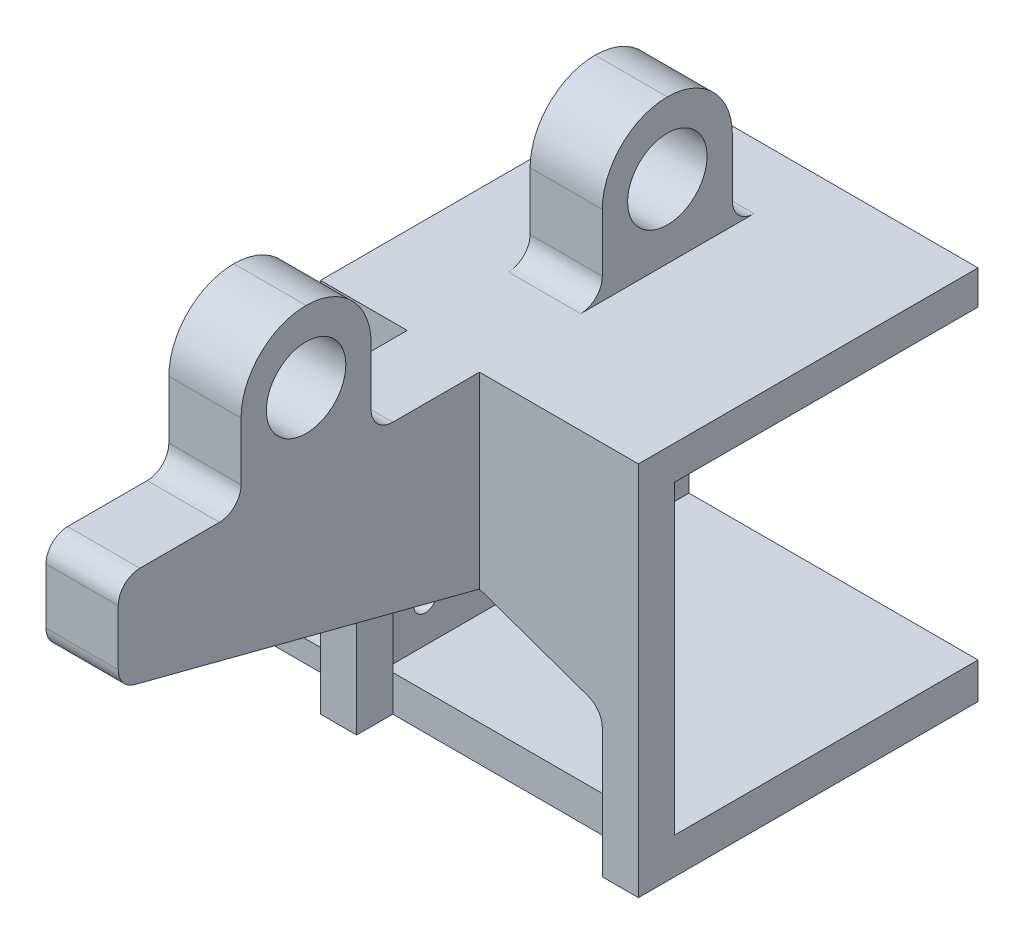
from build123d import *

# Parameters (mm, degrees)
SKETCH1_W            = 94
SKETCH1_H            = 42
BOSS_EXTRUDE1_DEPTH  = 3
SKETCH2_W            = 4
SKETCH2_H            = 42
BOSS_EXTRUDE2_DEPTH  = 47
SKETCH3_R            = 12.5
SKETCH3_R_2          = 1.6
CUT_EXTRUDE1_DEPTH   = 114.176852757
SKETCH4_W            = 42
SKETCH4_H            = 5
BOSS_EXTRUDE3_DEPTH  = 40
SKETCH5_W            = 42
SKETCH5_H            = 5
BOSS_EXTRUDE4_DEPTH  = 38
SKETCH7_W            = 42
SKETCH7_H            = 42
SKETCH7_W_2          = 44
BOSS_EXTRUDE6_DEPTH  = 5
SKETCH9_R            = 2.15
CUT_EXTRUDE2_DEPTH   = 149.731301346
SKETCH11_W           = 10
SKETCH11_H           = 18
BOSS_EXTRUDE7_DEPTH  = 20
SKETCH13_R           = 5.5
CUT_EXTRUDE3_DEPTH   = 169.988165266
BOSS_EXTRUDE11_DEPTH = 5
SKETCH23_W           = 10
SKETCH23_H           = 26
BOSS_EXTRUDE12_DEPTH = 50
CUT_EXTRUDE7_DEPTH   = 193.595430891
SKETCH25_W           = 10
SKETCH25_H           = 18
BOSS_EXTRUDE13_DEPTH = 20
SKETCH26_R           = 5.5
CUT_EXTRUDE8_DEPTH   = 193.595430891
SKETCH27_W           = 12
SKETCH27_H           = 18
BOSS_EXTRUDE14_DEPTH = 69
CUT_EXTRUDE10_START  = -5
SKETCH28_R           = 5.5
CUT_EXTRUDE10_DEPTH  = 5
SKETCH29_R           = 5.5
CUT_EXTRUDE11_DEPTH  = 5
FILLET4_R            = 9
FILLET3_R            = 3
SKETCH30_W           = 91
SKETCH30_H           = 42
CUT_EXTRUDE12_DEPTH  = 181.413414135
SKETCH31_W           = 40
SKETCH31_H           = 0.3
CUT_EXTRUDE13_DEPTH  = 42


# Some blends are built 0.0001 mm under size
with BuildPart() as part:
    # Sketch1 → Boss-Extrude1 (new body)
    with BuildSketch(Plane(origin=(0, 0, 0), x_dir=(1, 0, 0), z_dir=(0, 1, 0))):
        with Locations((47, -21)):
            Rectangle(SKETCH1_W, SKETCH1_H)
    extrude(amount=BOSS_EXTRUDE1_DEPTH)

    # Sketch2 → Boss-Extrude2 (add)
    with BuildSketch(Plane.XZ):
        with Locations((2, 21)):
            Rectangle(SKETCH2_W, SKETCH2_H)
        with Locations((92, 21)):
            Rectangle(SKETCH2_W, SKETCH2_H)
    extrude(amount=-BOSS_EXTRUDE2_DEPTH)

    # Sketch3 → Cut-Extrude1 (cut, through all)
    with BuildSketch(Plane(origin=(94, 0, 0), x_dir=(0, 0, -1), z_dir=(1, 0, 0))):
        with Locations((-21, 26)):
            Circle(SKETCH3_R)
        with Locations((-36.5, 41.5)):
            Circle(SKETCH3_R_2)
        with Locations((-5.5, 41.5)):
            Circle(SKETCH3_R_2)
        with Locations((-36.5, 10.5)):
            Circle(SKETCH3_R_2)
        with Locations((-5.5, 10.5)):
            Circle(SKETCH3_R_2)
    extrude(amount=-CUT_EXTRUDE1_DEPTH, mode=Mode.SUBTRACT)

    # Sketch4 → Boss-Extrude3 (add)
    with BuildSketch(Plane(origin=(94, 0, 0), x_dir=(0, 0, -1), z_dir=(1, 0, 0))):
        with Locations((-21, 2.5)):
            Rectangle(SKETCH4_W, SKETCH4_H)
    extrude(amount=BOSS_EXTRUDE3_DEPTH)

    # Sketch5 → Boss-Extrude4 (add)
    with BuildSketch(Plane.ZY):
        with Locations((21, 2.5)):
            Rectangle(SKETCH5_W, SKETCH5_H)
    extrude(amount=BOSS_EXTRUDE4_DEPTH)

    # Sketch7 → Boss-Extrude6 (add)
    with BuildSketch(Plane(origin=(0, 47, 0), x_dir=(1, 0, 0), z_dir=(0, 1, 0))):
        with Locations((-17, -21)):
            Rectangle(SKETCH7_W, SKETCH7_H)
        with Locations((112, -21)):
            Rectangle(SKETCH7_W_2, SKETCH7_H)
    extrude(amount=BOSS_EXTRUDE6_DEPTH)

    # Sketch9 → Cut-Extrude2 (cut, through all)
    with BuildSketch(Plane(origin=(0, 3, 0), x_dir=(1, 0, 0), z_dir=(0, 1, 0))):
        with Locations(Location((83, -21, 0), (0, 0, 270))):
            Circle(SKETCH9_R)
        with Locations(Location((65, -21, 0), (0, 0, 270))):
            Circle(SKETCH9_R)
        with Locations(Location((74, -12, 0), (0, 0, 270))):
            Circle(SKETCH9_R)
        with Locations(Location((74, -30, 0), (0, 0, 270))):
            Circle(SKETCH9_R)
        with Locations(Location((22, -12, 0), (0, 0, 270))):
            Circle(SKETCH9_R)
        with Locations(Location((22, -30, 0), (0, 0, 270))):
            Circle(SKETCH9_R)
    extrude(amount=-CUT_EXTRUDE2_DEPTH, mode=Mode.SUBTRACT)

    # Sketch11 → Boss-Extrude7 (add)
    with BuildSketch(Plane(origin=(0, 52, 0), x_dir=(1, 0, 0), z_dir=(0, 1, 0))):
        with Locations((-8, -21)):
            Rectangle(SKETCH11_W, SKETCH11_H)
        with Locations((107, -21)):
            Rectangle(SKETCH11_W, SKETCH11_H)
    extrude(amount=BOSS_EXTRUDE7_DEPTH)

    # Sketch13 → Cut-Extrude3 (cut, through all)
    with BuildSketch(Plane.ZY.offset(13)):
        with Locations((21, 62.15)):
            Circle(SKETCH13_R)
    extrude(amount=-CUT_EXTRUDE3_DEPTH, mode=Mode.SUBTRACT)

    # Sketch20 → Boss-Extrude11 (add)
    with BuildSketch(Plane.XY.offset(42)):
        Polygon((134, 0), (134, 52), (90, 52), (90, 0), (95, 0), (95, 20), (102, 26), (112, 26), (129, 20), (129, 0), align=None)
    extrude(amount=BOSS_EXTRUDE11_DEPTH)

    # Sketch23 → Boss-Extrude12 (add)
    with BuildSketch(Plane.XY.offset(47)):
        with Locations((107, 39)):
            Rectangle(SKETCH23_W, SKETCH23_H)
    extrude(amount=BOSS_EXTRUDE12_DEPTH)

    # Sketch24 → Cut-Extrude7 (cut, through all)
    with BuildSketch(Plane(origin=(112, 0, 0), x_dir=(0, 0, -1), z_dir=(1, 0, 0))):
        Polygon((-47, 26), (-97, 39), (-97, 26), align=None)
    extrude(amount=-CUT_EXTRUDE7_DEPTH, mode=Mode.SUBTRACT)

    # Sketch25 → Boss-Extrude13 (add)
    with BuildSketch(Plane(origin=(0, 52, 0), x_dir=(1, 0, 0), z_dir=(0, 1, 0))):
        with Locations((107, -71)):
            Rectangle(SKETCH25_W, SKETCH25_H)
    extrude(amount=BOSS_EXTRUDE13_DEPTH)

    # Sketch26 → Cut-Extrude8 (cut, through all)
    with BuildSketch(Plane(origin=(112, 0, 0), x_dir=(0, 0, -1), z_dir=(1, 0, 0))):
        with Locations((-71, 62.15)):
            Circle(SKETCH26_R)
    extrude(amount=-CUT_EXTRUDE8_DEPTH, mode=Mode.SUBTRACT)

    # Sketch27 → Boss-Extrude14 (add)
    with BuildSketch(Plane(origin=(0, 3, 0), x_dir=(1, 0, 0), z_dir=(0, 1, 0))):
        with Locations((47, -21)):
            Rectangle(SKETCH27_W, SKETCH27_H)
    extrude(amount=BOSS_EXTRUDE14_DEPTH)

    # Sketch28 → Cut-Extrude10 (cut)
    with BuildSketch(Plane(origin=(53, 0, 0), x_dir=(0, 0, -1), z_dir=(1, 0, 0)).offset(CUT_EXTRUDE10_START)):
        with Locations(Location((-21, 62.15, 0), (0, 0, 180))):
            Circle(SKETCH28_R)
    extrude(amount=CUT_EXTRUDE10_DEPTH, mode=Mode.SUBTRACT)

    # Sketch29 → Cut-Extrude11 (cut)
    with BuildSketch(Plane.ZY.offset(-41)):
        with Locations((21, 62.15)):
            Circle(SKETCH29_R)
    extrude(amount=-CUT_EXTRUDE11_DEPTH, mode=Mode.SUBTRACT)

    # Fillet4
    fillet4_edges = [part.edges().sort_by_distance(p)[0] for p in [
        (-8, 72, 12),
        (-8, 72, 30),
        (107, 72, 12),
        (107, 72, 30),
        (107, 72, 62),
        (107, 72, 80),
        (47, 72, 12),
        (47, 72, 30),
    ]]
    fillet(fillet4_edges, radius=FILLET4_R - 0.0001)  # a hair under: the kernel refuses the full size

    # Fillet3
    # the kernel refuses this fillet: 3 mm, written as the material it adds along each edge
    with BuildSketch(Plane(origin=(-3, 52, 30), x_dir=(0, 1, 0), z_dir=(-1, 0, 0)), Plane(origin=(112, 52, 80), x_dir=(0, 1, 0), z_dir=(-1, 0, 0))) as fillet3_piece_1:
        with BuildLine():
            CenterArc((FILLET3_R, -FILLET3_R), FILLET3_R, 90, 90)
            Line((0, -FILLET3_R), (0, 0))
            Line((0, 0), (FILLET3_R, 0))
        make_face()
    extrude(amount=10)
    with BuildSketch(Plane(origin=(-13, 52, 12), x_dir=(0, 0, -1), z_dir=(1, 0, 0)), Plane(origin=(112, 52, 30), x_dir=(0, 0, 1), z_dir=(-1, 0, 0)), Plane(origin=(102, 52, 12), x_dir=(0, 0, -1), z_dir=(1, 0, 0)), Plane(origin=(102, 52, 62), x_dir=(0, 0, -1), z_dir=(1, 0, 0))) as fillet3_piece_2:
        with BuildLine():
            CenterArc((FILLET3_R, FILLET3_R), FILLET3_R, 180, 90)
            Line((0, FILLET3_R), (0, 0))
            Line((0, 0), (FILLET3_R, 0))
        make_face()
    extrude(amount=10)
    with BuildSketch(Plane(origin=(95, 20, 42), x_dir=(0, -1, 0), z_dir=(0, 0, 1))) as fillet3_piece_3:
        with BuildLine():
            CenterArc((FILLET3_R * 0.45993492247, FILLET3_R), FILLET3_R, 220.601294645, 49.398705355)
            Line((-FILLET3_R * 0.299321679895, FILLET3_R * 0.349208626544), (0, 0))
            Line((0, 0), (FILLET3_R * 0.45993492247, 0))
        make_face()
    extrude(amount=5)
    with BuildSketch(Plane(origin=(102, 26, 42), x_dir=(-0.7592566023652966, -0.6507913734559685, 0), z_dir=(0, 0, 1))) as fillet3_piece_4:
        with BuildLine():
            CenterArc((FILLET3_R * 0.369924076215, FILLET3_R), FILLET3_R, 229.398705355, 40.601294645)
            Line((-FILLET3_R * 0.28086729724, FILLET3_R * 0.240743397635), (0, 0))
            Line((0, 0), (FILLET3_R * 0.369924076215, 0))
        make_face()
    extrude(amount=5)
    with BuildSketch(Plane(origin=(112, 26, 42), x_dir=(0.942990333582889, -0.3328201177351389, 0), z_dir=(0, 0, 1))) as fillet3_piece_5:
        with BuildLine():
            CenterArc((FILLET3_R * 0.171292729553, -FILLET3_R), FILLET3_R, 90, 19.440034828)
            Line((-FILLET3_R * 0.161527388182, -FILLET3_R * 0.0570096664171), (0, 0))
            Line((0, 0), (FILLET3_R * 0.171292729553, 0))
        make_face()
    extrude(amount=5)
    with BuildSketch(Plane(origin=(129, 20, 42), x_dir=(0, -1, 0), z_dir=(0, 0, 1))) as fillet3_piece_6:
        with BuildLine():
            CenterArc((FILLET3_R * 0.707515081019, -FILLET3_R), FILLET3_R, 90, 70.559965172)
            Line((-FILLET3_R * 0.235475252564, -FILLET3_R * 0.667179882265), (0, 0))
            Line((0, 0), (FILLET3_R * 0.707515081019, 0))
        make_face()
    extrude(amount=5)
    with BuildSketch(Plane(origin=(53, 3, 30), x_dir=(0, 0, 1), z_dir=(-1, 0, 0)), Plane(origin=(41, 3, 12), x_dir=(0, 0, -1), z_dir=(1, 0, 0))) as fillet3_piece_7:
        with BuildLine():
            CenterArc((FILLET3_R, FILLET3_R), FILLET3_R, 180, 90)
            Line((0, FILLET3_R), (0, 0))
            Line((0, 0), (FILLET3_R, 0))
        make_face()
    extrude(amount=12)
    # the kernel refuses this fillet: 3 mm, written as the material it takes off along each edge
    with BuildSketch(Plane(origin=(94.5, 52, 97), x_dir=(0, 0, -1), z_dir=(1, 0, 0))) as fillet3_2_piece_1:
        with BuildLine():
            CenterArc((FILLET3_R, -FILLET3_R), FILLET3_R, 90, 90)
            Line((0, -FILLET3_R), (0, 0))
            Line((0, 0), (FILLET3_R, 0))
        make_face()
    extrude(amount=25, mode=Mode.SUBTRACT)
    with BuildSketch(Plane(origin=(117.799354812, 39, 97), x_dir=(0, -0.25163385176495195, -0.9678225067882716), z_dir=(-1, 0, 0))) as fillet3_2_piece_2:
        with BuildLine():
            CenterArc((FILLET3_R * 0.773247308247, -FILLET3_R), FILLET3_R, 90, 75.425783802)
            Line((-FILLET3_R * 0.194575198541, -FILLET3_R * 0.748366148235), (0, 0))
            Line((0, 0), (FILLET3_R * 0.773247308247, 0))
        make_face()
    extrude(amount=21.598709624, mode=Mode.SUBTRACT)

    # Sketch30 → Cut-Extrude12 (cut, through all)
    with BuildSketch(Plane.XZ):
        with Locations((7.5, 21)):
            Rectangle(SKETCH30_W, SKETCH30_H)
    extrude(amount=-CUT_EXTRUDE12_DEPTH, mode=Mode.SUBTRACT)

    # Sketch31 → Cut-Extrude13 (cut)
    with BuildSketch(Plane(origin=(0, 0, 0), x_dir=(-1, 0, 0), z_dir=(0, 0, -1))):
        with Locations((-114, 47.15)):
            Rectangle(SKETCH31_W, SKETCH31_H)
    extrude(amount=-CUT_EXTRUDE13_DEPTH, mode=Mode.SUBTRACT)


solid = part.part
